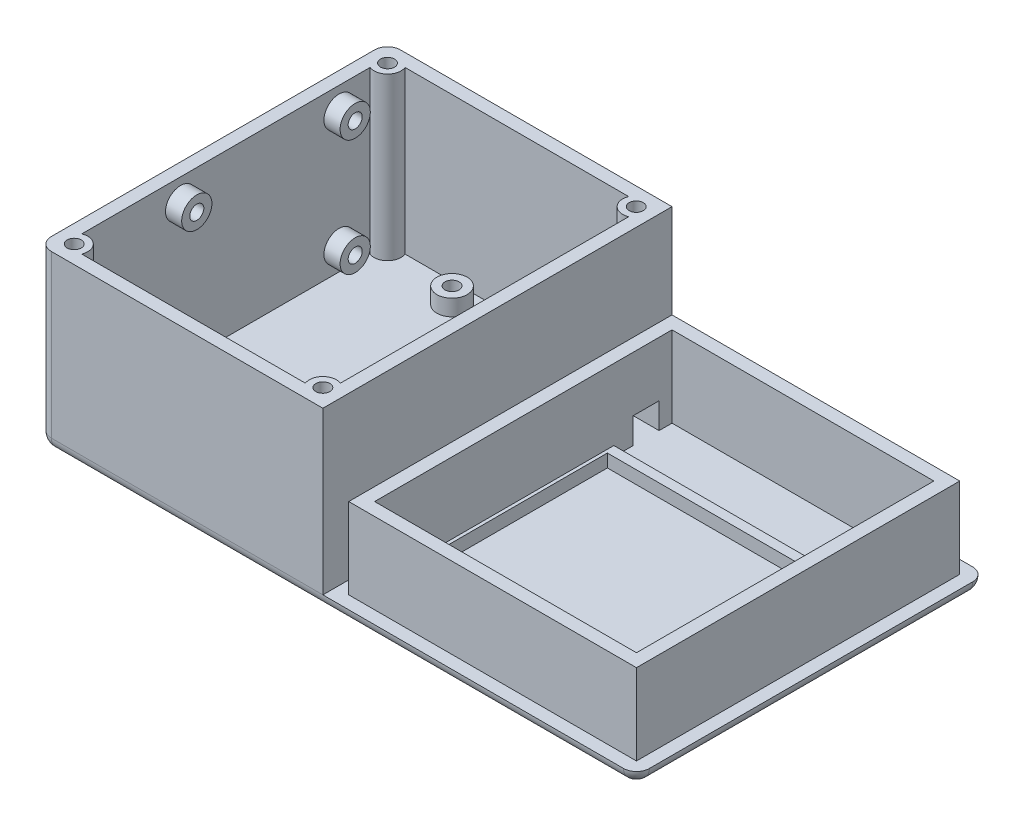
from build123d import *

# Parameters (mm, degrees)
BOSS_EXTRUDE1_DEPTH = 4
FILLET1_R           = 4
SKETCH4_W           = 4
SKETCH4_H           = 4
SKETCH4_H_2         = 100
BOSS_EXTRUDE2_DEPTH = 50
BOSS_EXTRUDE3_DEPTH = 25
BOSS_EXTRUDE4_DEPTH = 12
SKETCH5_3_W         = 8
SKETCH5_3_H         = 8
CUT_EXTRUDE1_DEPTH  = 12
SKETCH6_W           = 79
SKETCH6_H           = 50
CUT_EXTRUDE2_DEPTH  = 1
SKETCH6_3_W         = 81
SKETCH6_3_H         = 56
SKETCH6_3_W_2       = 79
SKETCH6_3_H_2       = 50
BOSS_EXTRUDE5_DEPTH = 3
SKETCH7_R           = 4.175
BOSS_EXTRUDE6_DEPTH = 50
CUT_EXTRUDE3_START  = 50
SKETCH7_2_R         = 2.175
CUT_EXTRUDE3_DEPTH  = 5
SKETCH9_R           = 4.675
SKETCH9_R_2         = 2.175
BOSS_EXTRUDE7_DEPTH = 5
SKETCH10_R          = 4.675
SKETCH10_R_2        = 2.175
BOSS_EXTRUDE8_DEPTH = 5


with BuildPart() as part:
    # Sketch1 → Boss-Extrude1 (new body)
    with BuildSketch(Plane(origin=(0, 0, 0), x_dir=(1, 0, 0), z_dir=(0, 1, 0))):
        with BuildLine():
            Line((-88.5, -54), (88.5, -54))
            ThreePointArc((88.5, -54), (91.328427125, -52.828427125), (92.5, -50))
            Line((92.5, -50), (92.5, 50))
            ThreePointArc((92.5, 50), (91.328427125, 52.828427125), (88.5, 54))
            Line((88.5, 54), (-88.5, 54))
            ThreePointArc((-88.5, 54), (-91.328427125, 52.828427125), (-92.5, 50))
            Line((-92.5, 50), (-92.5, -50))
            ThreePointArc((-92.5, -50), (-91.328427125, -52.828427125), (-88.5, -54))
        make_face()
    extrude(amount=BOSS_EXTRUDE1_DEPTH)

    # Fillet1
    fillet1_edges = [part.edges().sort_by_distance(p)[0] for p in [
        (0, 0, 54),
        (91.328427125, 0, 52.828427125),
        (92.5, 0, 0),
        (91.328427125, 0, -52.828427125),
        (0, 0, -54),
        (-91.328427125, 0, -52.828427125),
        (-92.5, 0, 0),
        (-91.328427125, 0, 52.828427125),
    ]]
    fillet(fillet1_edges, radius=FILLET1_R - 0.0001)  # a hair under: the kernel refuses the full size

    # Sketch4 → Boss-Extrude2 (add)
    with BuildSketch(Plane(origin=(0, 4, 0), x_dir=(1, 0, 0), z_dir=(0, 1, 0))):
        with BuildLine():
            ThreePointArc((-92.5, -50), (-91.328427125, -52.828427125), (-88.5, -54))
            Line((-88.5, -54), (-8.5, -54))
            Line((-8.5, -54), (-8.5, -50))
            Line((-8.5, -50), (-88.5, -50))
            Line((-88.5, -50), (-88.5, 50))
            Line((-88.5, 50), (-8.5, 50))
            Line((-8.5, 50), (-8.5, 54))
            Line((-8.5, 54), (-88.5, 54))
            ThreePointArc((-88.5, 54), (-91.328427125, 52.828427125), (-92.5, 50))
            Line((-92.5, 50), (-92.5, -50))
        make_face()
        with Locations((-6.5, 52)):
            Rectangle(SKETCH4_W, SKETCH4_H)
        with Locations((-6.5, 0)):
            Rectangle(SKETCH4_W, SKETCH4_H_2)
        with Locations((-6.5, -52)):
            Rectangle(SKETCH4_W, SKETCH4_H)
    extrude(amount=BOSS_EXTRUDE2_DEPTH)

    # Sketch4<3> → Boss-Extrude3 (add)
    with BuildSketch(Plane(origin=(0, 4, 0), x_dir=(1, 0, 0), z_dir=(0, 1, 0))):
        Polygon((-0.5, 50), (-0.5, -50), (3.5, -50), (3.5, -46), (3.5, 46), (3.5, 50), align=None)
        Polygon((3.5, -46), (3.5, -50), (88.5, -50), (88.5, 50), (3.5, 50), (3.5, 46), (84.5, 46), (84.5, -46), align=None)
    extrude(amount=BOSS_EXTRUDE3_DEPTH)

    # Sketch5 → Boss-Extrude4 (add)
    with BuildSketch(Plane.ZY.offset(8.5)):
        Polygon((-46, 4), (-42, 4), (-42, 12), (-34, 12), (-34, 4), (-30, 4), (-30, 16), (-46, 16), align=None)
    extrude(amount=-BOSS_EXTRUDE4_DEPTH)

    # Sketch5<3> → Cut-Extrude1 (cut)
    with BuildSketch(Plane.ZY.offset(8.5)):
        with Locations((-38, 8)):
            Rectangle(SKETCH5_3_W, SKETCH5_3_H)
    extrude(amount=-CUT_EXTRUDE1_DEPTH, mode=Mode.SUBTRACT)

    # Sketch6 → Cut-Extrude2 (cut)
    with BuildSketch(Plane(origin=(0, 4, 0), x_dir=(1, 0, 0), z_dir=(0, 1, 0))):
        with Locations((44, 0)):
            Rectangle(SKETCH6_W, SKETCH6_H)
    extrude(amount=-CUT_EXTRUDE2_DEPTH, mode=Mode.SUBTRACT)

    # Sketch6<3> → Boss-Extrude5 (add)
    with BuildSketch(Plane(origin=(0, 4, 0), x_dir=(1, 0, 0), z_dir=(0, 1, 0))):
        with Locations((44, 0)):
            Rectangle(SKETCH6_3_W, SKETCH6_3_H)
        with Locations((44, 0)):
            Rectangle(SKETCH6_3_W_2, SKETCH6_3_H_2, mode=Mode.SUBTRACT)
    extrude(amount=BOSS_EXTRUDE5_DEPTH)

    # Sketch7 → Boss-Extrude6 (add)
    with BuildSketch(Plane(origin=(0, 4, 0), x_dir=(1, 0, 0), z_dir=(0, 1, 0))):
        with Locations((-86.962042751, 48.462042751)):
            Circle(SKETCH7_R)
        with Locations((-10.037957249, 48.462042751)):
            Circle(SKETCH7_R)
        with Locations((-10.037957249, -48.462042751)):
            Circle(SKETCH7_R)
        with Locations((-86.962042751, -48.462042751)):
            Circle(SKETCH7_R)
    extrude(amount=BOSS_EXTRUDE6_DEPTH)

    # Sketch7<2> → Cut-Extrude3 (cut)
    with BuildSketch(Plane(origin=(0, 4, 0), x_dir=(1, 0, 0), z_dir=(0, 1, 0)).offset(CUT_EXTRUDE3_START)):
        with Locations(Location((-86.962042751, 48.462042751, 0), (0, 0, 270))):
            Circle(SKETCH7_2_R)
        with Locations(Location((-10.037957249, 48.462042751, 0), (0, 0, 270))):
            Circle(SKETCH7_2_R)
        with Locations(Location((-10.037957249, -48.462042751, 0), (0, 0, 270))):
            Circle(SKETCH7_2_R)
        with Locations(Location((-86.962042751, -48.462042751, 0), (0, 0, 270))):
            Circle(SKETCH7_2_R)
    extrude(amount=-CUT_EXTRUDE3_DEPTH, mode=Mode.SUBTRACT)

    # Sketch9 → Boss-Extrude7 (add)
    # profile 1 of 4: a face of its own
    with BuildSketch(Plane(origin=(0, 4, 0), x_dir=(1, 0, 0), z_dir=(0, 1, 0))):
        with Locations(Location((-62.3, 43.75, 0), (0, 0, 90))):
            Circle(SKETCH9_R)
        with Locations(Location((-62.3, 43.75, 0), (0, 0, 270))):
            Circle(SKETCH9_R_2, mode=Mode.SUBTRACT)
    # profile 2 of 4: a face of its own
    with BuildSketch(Plane(origin=(0, 4, 0), x_dir=(1, 0, 0), z_dir=(0, 1, 0))):
        with Locations(Location((-20.3, 43.75, 0), (0, 0, 90))):
            Circle(SKETCH9_R)
        with Locations(Location((-20.3, 43.75, 0), (0, 0, 270))):
            Circle(SKETCH9_R_2, mode=Mode.SUBTRACT)
    # profile 3 of 4: a face of its own
    with BuildSketch(Plane(origin=(0, 4, 0), x_dir=(1, 0, 0), z_dir=(0, 1, 0))):
        with Locations(Location((-62.3, -16.25, 0), (0, 0, 90))):
            Circle(SKETCH9_R)
        with Locations(Location((-62.3, -16.25, 0), (0, 0, 270))):
            Circle(SKETCH9_R_2, mode=Mode.SUBTRACT)
    # profile 4 of 4: a face of its own
    with BuildSketch(Plane(origin=(0, 4, 0), x_dir=(1, 0, 0), z_dir=(0, 1, 0))):
        with Locations(Location((-20.3, -16.25, 0), (0, 0, 90))):
            Circle(SKETCH9_R)
        with Locations(Location((-20.3, -16.25, 0), (0, 0, 270))):
            Circle(SKETCH9_R_2, mode=Mode.SUBTRACT)
    extrude(amount=BOSS_EXTRUDE7_DEPTH)

    # Sketch10 → Boss-Extrude8 (add)
    # profile 1 of 4: a face of its own
    with BuildSketch(Plane(origin=(-88.5, 0, 0), x_dir=(0, 0, -1), z_dir=(1, 0, 0))):
        with Locations((-14, 47)):
            Circle(SKETCH10_R)
        with Locations((-14, 47)):
            Circle(SKETCH10_R_2, mode=Mode.SUBTRACT)
    # profile 2 of 4: a face of its own
    with BuildSketch(Plane(origin=(-88.5, 0, 0), x_dir=(0, 0, -1), z_dir=(1, 0, 0))):
        with Locations((35, 47)):
            Circle(SKETCH10_R)
        with Locations((35, 47)):
            Circle(SKETCH10_R_2, mode=Mode.SUBTRACT)
    # profile 3 of 4: a face of its own
    with BuildSketch(Plane(origin=(-88.5, 0, 0), x_dir=(0, 0, -1), z_dir=(1, 0, 0))):
        with Locations((35, 11)):
            Circle(SKETCH10_R)
        with Locations((35, 11)):
            Circle(SKETCH10_R_2, mode=Mode.SUBTRACT)
    # profile 4 of 4: a face of its own
    with BuildSketch(Plane(origin=(-88.5, 0, 0), x_dir=(0, 0, -1), z_dir=(1, 0, 0))):
        with Locations((-14, 11)):
            Circle(SKETCH10_R)
        with Locations((-14, 11)):
            Circle(SKETCH10_R_2, mode=Mode.SUBTRACT)
    extrude(amount=BOSS_EXTRUDE8_DEPTH)


solid = part.part
